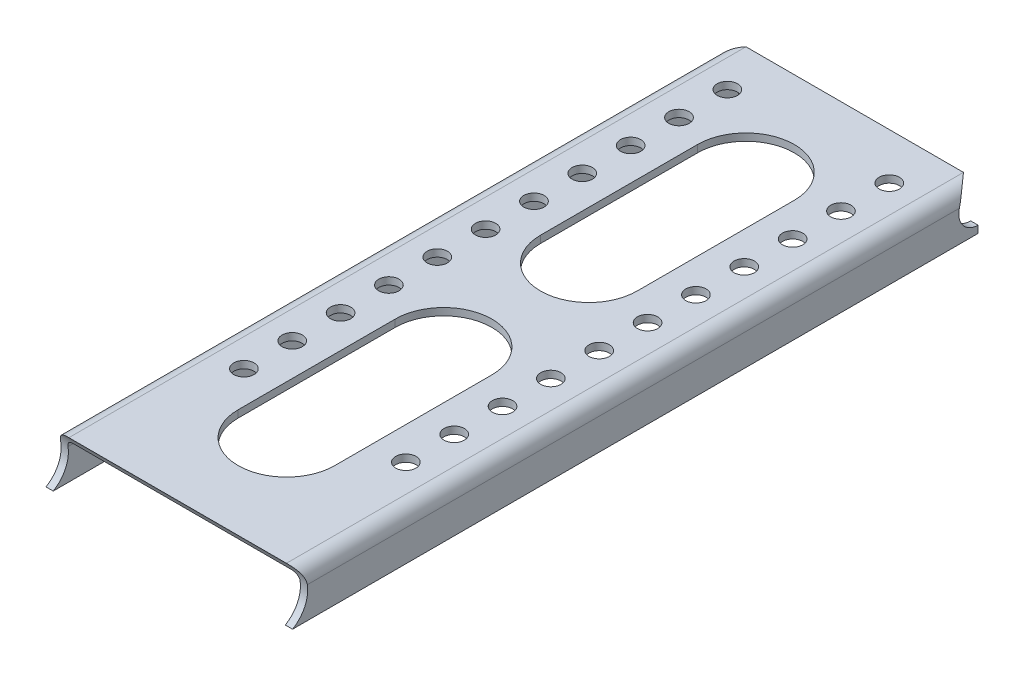
from build123d import *

# Parameters (mm, degrees)
SKETCH1_W                   = 90
SKETCH1_H                   = 290
BASE_FLANGE1_DEPTH          = 3
SM_EDGE_FLANGE_1_DEPTH      = 290
SM_EDGE_FLANGE_1_BEND_DEPTH = 290
INDENT1_START               = 23
INDENT1_DEPTH               = 104
INDENT1_START_2             = 26.270388893
INDENT1_2_DEPTH             = 97.459222009
INDENT1_3_DEPTH             = 0.729611107
INDENT1_START_3             = 123
INDENT1_4_DEPTH             = 0.729610902
INDENT1_START_4             = 119.9999999
INDENT1_5_DEPTH             = 6.0000001
INDENT1_START_5             = 24
INDENT1_6_DEPTH             = 6
INDENT1_START_6             = -290
INDENT1_7_DEPTH             = 6.65
INDENT2_START               = 23
INDENT2_DEPTH               = 104
INDENT2_START_2             = -11.0000001
INDENT2_2_DEPTH             = 11.0000001
INDENT2_START_3             = 24
INDENT2_3_DEPTH             = 102
CUT_EXTRUDE1_DEPTH          = 317.754179273
CUT_EXTRUDE1_DEPTH_BACK     = 317.754179273
SKETCH15_R                  = 4.2
CUT_EXTRUDE2_DEPTH          = 317.754179273
CUT_EXTRUDE2_DEPTH_BACK     = 317.754179273


with BuildPart() as part:
    # Base-Flange1: sheet metal written as solids
    # Sketch1 → Base-Flange1 (new body)
    with BuildSketch(Plane(origin=(0, 207.95, 0), x_dir=(1, 0, 0), z_dir=(0, 1, 0))):
        with Locations((75, 145)):
            Rectangle(SKETCH1_W, SKETCH1_H)
    extrude(amount=-BASE_FLANGE1_DEPTH)

    # 邊線-凸緣1: sheet metal written as solids
    # 邊線-凸緣1 section (on a plane across the edge) → 邊線-凸緣1 (add)
    with BuildSketch(Plane(origin=(27, 204.95, 0), x_dir=(1, 0, 0), z_dir=(0, 0, -1))):
        with BuildLine():
            Line((-3, 3), (-3, 15.9))
            Line((-3, 15.9), (0, 15.9))
            Line((0, 15.9), (0, 3))
            ThreePointArc((0, 3), (0.878679656, 0.878679656), (3, 0))
            Line((3, 0), (3, -3))
            ThreePointArc((3, -3), (-1.242640687, -1.242640687), (-3, 3))
        make_face()
    extrude(amount=SM_EDGE_FLANGE_1_DEPTH)

    # 邊線-凸緣1 section 2 (on a plane across the edge) → 邊線-凸緣1 bend (add)
    with BuildSketch(Plane(origin=(123, 204.95, -290), x_dir=(-1, 0, 0), z_dir=(0, 0, 1))):
        with BuildLine():
            Line((-3, 3), (-3, 15.9))
            Line((-3, 15.9), (0, 15.9))
            Line((0, 15.9), (0, 3))
            ThreePointArc((0, 3), (0.878679656, 0.878679656), (3, 0))
            Line((3, 0), (3, -3))
            ThreePointArc((3, -3), (-1.242640687, -1.242640687), (-3, 3))
        make_face()
    extrude(amount=SM_EDGE_FLANGE_1_BEND_DEPTH)

    # Indent1: read off the stored shape, not the designer's step
    # Indent1 outline → Indent1 (cut)
    with BuildSketch(Plane.YZ.offset(INDENT1_START)):
        with BuildLine():
            Line((192.05, -290), (207.95, -290))
            ThreePointArc((207.95, -290), (200, -282.05), (192.05, -290))
        make_face()
    extrude(amount=INDENT1_DEPTH, mode=Mode.SUBTRACT)

    # Indent2: read off the stored shape, not the designer's step
    # Indent2 outline → Indent2 (cut)
    with BuildSketch(Plane.YZ.offset(INDENT2_START)):
        with BuildLine():
            ThreePointArc((189.05, -6.433311744), (197.7062633, -12.491147744), (207.950014124, -9.903902031))
            Line((207.950014124, -9.903902031), (209, -9.061062257))
            Line((209, -9.061062257), (209, 1))
            Line((209, 1), (188, 1))
            Line((188, 1), (188, 0))
            Line((188, 0), (188, -4.64612958))
            Line((188, -4.64612958), (189.05, -6.433311744))
        make_face()
    extrude(amount=INDENT2_DEPTH, mode=Mode.SUBTRACT)

    # Sketch15 → Cut-Extrude1 (cut, two sides: drawn at the far end of the back side and taken through both)
    with BuildSketch(Plane(origin=(0, 207.95, 0), x_dir=(1, 0, 0), z_dir=(0, 1, 0)).offset(-CUT_EXTRUDE1_DEPTH_BACK)):
        with Locations((41.5, 270.8)):
            Circle(SKETCH15_R)
        with Locations((108.5, 270.8)):
            Circle(SKETCH15_R)
        with Locations((41.5, 250.8)):
            Circle(SKETCH15_R)
        with Locations((108.5, 250.8)):
            Circle(SKETCH15_R)
        with Locations((41.5, 230.8)):
            Circle(SKETCH15_R)
        with Locations((108.5, 230.8)):
            Circle(SKETCH15_R)
        with Locations((41.5, 210.8)):
            Circle(SKETCH15_R)
        with Locations((108.5, 210.8)):
            Circle(SKETCH15_R)
        with Locations((41.5, 190.8)):
            Circle(SKETCH15_R)
        with Locations((108.5, 190.8)):
            Circle(SKETCH15_R)
        with Locations((41.5, 170.8)):
            Circle(SKETCH15_R)
        with Locations((108.5, 170.8)):
            Circle(SKETCH15_R)
        with Locations((41.5, 150.8)):
            Circle(SKETCH15_R)
        with Locations((108.5, 150.8)):
            Circle(SKETCH15_R)
        with Locations((41.5, 130.8)):
            Circle(SKETCH15_R)
        with Locations((108.5, 130.8)):
            Circle(SKETCH15_R)
        with Locations((41.5, 110.8)):
            Circle(SKETCH15_R)
        with Locations((108.5, 110.8)):
            Circle(SKETCH15_R)
        with Locations((41.5, 90.8)):
            Circle(SKETCH15_R)
        with Locations((108.5, 90.8)):
            Circle(SKETCH15_R)
        with Locations((41.5, 70.8)):
            Circle(SKETCH15_R)
        with Locations((108.5, 70.8)):
            Circle(SKETCH15_R)
    extrude(amount=CUT_EXTRUDE1_DEPTH + CUT_EXTRUDE1_DEPTH_BACK, mode=Mode.SUBTRACT)

    # Sketch16 → Cut-Extrude2 (cut, two sides: drawn at the far end of the back side and taken through both)
    with BuildSketch(Plane(origin=(0, 207.95, 0), x_dir=(1, 0, 0), z_dir=(0, 1, 0)).offset(-CUT_EXTRUDE2_DEPTH_BACK)):
        with BuildLine():
            Line((55, 54.903913368), (55, 119.903913368))
            ThreePointArc((55, 119.903913368), (75, 139.903913368), (95, 119.903913368))
            Line((95, 119.903913368), (95, 54.903913368))
            ThreePointArc((95, 54.903913368), (75, 34.903913368), (55, 54.903913368))
        make_face()
        with BuildLine():
            Line((55, 180), (55, 245))
            ThreePointArc((55, 245), (75, 265), (95, 245))
            Line((95, 245), (95, 180))
            ThreePointArc((95, 180), (75, 160), (55, 180))
        make_face()
    extrude(amount=CUT_EXTRUDE2_DEPTH + CUT_EXTRUDE2_DEPTH_BACK, mode=Mode.SUBTRACT)


with BuildPart() as body_2:
    # Indent1 2 outline → Indent1 2 (new body)
    with BuildSketch(Plane.YZ.offset(INDENT1_START_2)):
        with BuildLine():
            Line((204.95, -285.559279338), (204.95, -290))
            Line((204.95, -290), (206.65, -290))
            ThreePointArc((206.65, -290), (206.210475022, -287.622501314), (204.95, -285.559279338))
        make_face()
    extrude(amount=INDENT1_2_DEPTH)

    # Indent1 3 outline → Indent1 3 (add)
    with BuildSketch(Plane.YZ.offset(INDENT1_START_2)):
        with BuildLine():
            Line((193.35, -290), (204.95, -290))
            Line((204.95, -290), (204.95, -285.559279338))
            ThreePointArc((204.95, -285.559279338), (197.622501314, -283.789524978), (193.35, -290))
        make_face()
    extrude(amount=INDENT1_3_DEPTH)

    # Indent1 4 outline → Indent1 4 (add)
    with BuildSketch(Plane.YZ.offset(INDENT1_START_3)):
        with BuildLine():
            Line((193.35, -290), (204.95, -290))
            Line((204.95, -290), (204.95, -285.559279338))
            ThreePointArc((204.95, -285.559279338), (197.622501314, -283.789524978), (193.35, -290))
        make_face()
    extrude(amount=INDENT1_4_DEPTH)

    # Indent1 5 outline → Indent1 5 (add)
    with BuildSketch(Plane.YZ.offset(INDENT1_START_4)):
        with BuildLine():
            Line((193.35, -290), (206.65, -290))
            ThreePointArc((206.65, -290), (200, -283.35), (193.35, -290))
        make_face()
    extrude(amount=INDENT1_5_DEPTH)

    # Indent1 6 outline → Indent1 6 (add)
    with BuildSketch(Plane.YZ.offset(INDENT1_START_5)):
        with BuildLine():
            Line((193.35, -290), (206.65, -290))
            ThreePointArc((206.65, -290), (200, -283.35), (193.35, -290))
        make_face()
    extrude(amount=INDENT1_6_DEPTH)

    # Indent1 7 outline → Indent1 7 (cut)
    with BuildSketch(Plane.XY.offset(INDENT1_START_6)):
        with BuildLine():
            Line((123, 192), (123, 201.95))
            ThreePointArc((123, 201.95), (122.121320344, 204.071320344), (120, 204.95))
            Line((120, 204.95), (119.9999999, 192))
            Line((119.9999999, 192), (123, 192))
        make_face()
        with BuildLine():
            Line((27, 192), (30, 192))
            Line((30, 192), (30, 204.95))
            ThreePointArc((30, 204.95), (27.878679656, 204.071320344), (27, 201.95))
            Line((27, 201.95), (27, 192))
        make_face()
        with BuildLine():
            ThreePointArc((123.729603466, 206.650006169), (125.402666971, 204.559825589), (126, 201.95))
            Line((126, 201.95), (126, 208))
            Line((126, 208), (122.028355761, 208))
            Line((122.028355761, 208), (123.729603466, 206.650006169))
        make_face()
        with BuildLine():
            Line((24, 208), (24, 201.95))
            ThreePointArc((24, 201.95), (24.597331636, 204.559822705), (26.270391517, 206.650002187))
            Line((26.270391517, 206.650002187), (27.971640511, 208))
            Line((27.971640511, 208), (24, 208))
        make_face()
    extrude(amount=INDENT1_7_DEPTH, mode=Mode.SUBTRACT)


with BuildPart() as body_3:
    # Indent2 2 outline → Indent2 2 (new body)
    with BuildSketch(Plane.XY.offset(INDENT2_START_2)):
        with BuildLine():
            Line((24, 201.95), (24, 189.05))
            Line((24, 189.05), (27, 189.05))
            Line((27, 189.05), (27, 201.95))
            ThreePointArc((27, 201.95), (27.878679656, 204.071320344), (30, 204.95))
            Line((30, 204.95), (120, 204.95))
            ThreePointArc((120, 204.95), (122.121320344, 204.071320344), (123, 201.95))
            Line((123, 201.95), (123, 189.05))
            Line((123, 189.05), (126, 189.05))
            Line((126, 189.05), (126, 201.95))
            ThreePointArc((126, 201.95), (124.242640687, 206.192640687), (120, 207.95))
            Line((120, 207.95), (30, 207.95))
            ThreePointArc((30, 207.95), (25.757359313, 206.192640687), (24, 201.95))
        make_face()
    extrude(amount=INDENT2_2_DEPTH)

    # Indent2 3 outline → Indent2 3 (cut)
    with BuildSketch(Plane.YZ.offset(INDENT2_START_3)):
        with BuildLine():
            Line((207.95, -11.0000001), (207.950016725, -7.602449216))
            ThreePointArc((207.950016725, -7.602449216), (204.322791843, -10.115012145), (200.000000001, -11))
            Line((200.000000001, -11), (207.95, -11.0000001))
        make_face()
        with BuildLine():
            Line((189.05, -11.0000001), (200.000000001, -11))
            ThreePointArc((200.000000001, -11), (192.601479194, -8.140140655), (189.05, -1.047616342))
            Line((189.05, -1.047616342), (189.05, -11.0000001))
        make_face()
    extrude(amount=INDENT2_3_DEPTH, mode=Mode.SUBTRACT)


solid = part.part
